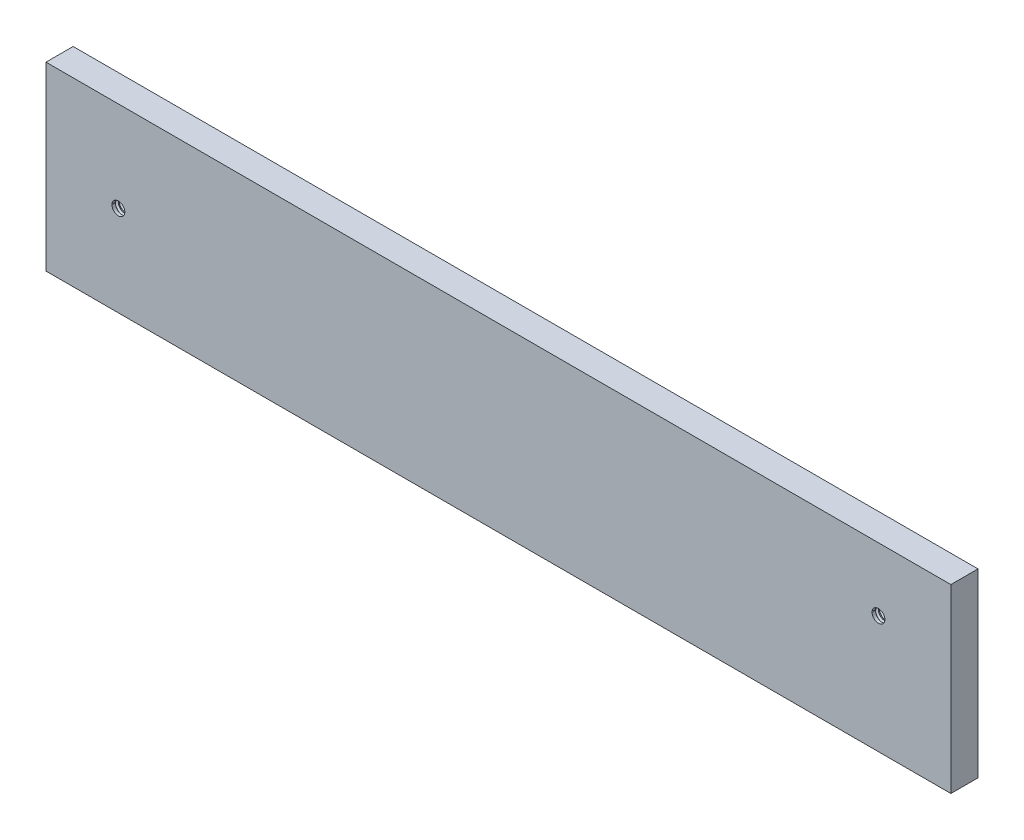
from build123d import *
from build123d.topology import SkipClean

# Parameters (mm, degrees)
SKETCH1_W           = 158.75
SKETCH1_H           = 31.75
BOSS_EXTRUDE1_DEPTH = 4.7625
SKETCH2_R           = 1.1303
CUT_EXTRUDE1_DEPTH  = 127.612750018
THREAD1_PITCH       = 0.635
THREAD2_PITCH       = 0.635


with BuildPart() as part:
    # Sketch1 → Boss-Extrude1 (new body)
    with BuildSketch(Plane.XY):
        with Locations((44.816346154, -8.303846154)):
            Rectangle(SKETCH1_W, SKETCH1_H)
    extrude(amount=-BOSS_EXTRUDE1_DEPTH)

    # Sketch2 → Cut-Extrude1 (cut, through all)
    with BuildSketch(Plane.XY):
        with Locations((-21.858653846, -8.303846154)):
            Circle(SKETCH2_R)
        with Locations((111.491346154, -3.541346154)):
            Circle(SKETCH2_R)
    extrude(amount=-CUT_EXTRUDE1_DEPTH, mode=Mode.SUBTRACT)

    # Thread1: the profile of Thread Profile1 profile screwed along a right-hand helix of 15.748031 turns, 6 arcs to a turn; built about Z, then put on its axis
    with SkipClean():  # the faces are left unmerged after this step: merging them gives an invalid solid
        thread1_z = Axis((0, 0, 0), (0, 0, 1))
        thread1_corners = [(1.13, 0, -0.000173205), (1.474003831, 0, 0.198437499), (1.474003831, 0, 0.277812499), (1.13, 0, 0.476423203)]
        with BuildLine(mode=Mode.PRIVATE) as thread1_profile:
            Line(thread1_corners[0], thread1_corners[1])
            Line(thread1_corners[1], thread1_corners[2])
            Line(thread1_corners[2], thread1_corners[3])
            Line(thread1_corners[3], thread1_corners[0])
        thread1_cap = Face(thread1_profile.wire())
        thread1_turn_angles = [0, 30, 60, 90, 120, 150, 180, 210, 240, 270, 300, 330, 360]
        thread1_turn_weights = [1, 0.8660254037844387, 1, 0.8660254037844387, 1, 0.8660254037844387, 1, 0.8660254037844387, 1, 0.8660254037844387, 1, 0.8660254037844387, 1]
        thread1_turn_rails = [Edge.make_bspline([Vector(p[0], p[1], 0).rotate(thread1_z, thread1_turn_angles[k]) / thread1_turn_weights[k] + Vector(0, 0, p[2] + THREAD1_PITCH * thread1_turn_angles[k] / 360) for k in range(13)], [0, 0, 0, 1, 1, 2, 2, 3, 3, 4, 4, 5, 5, 6, 6, 6], 2, thread1_turn_weights) for p in thread1_corners]
        thread1_turn_sides = [Face.make_surface_from_curves(thread1_turn_rails[p[0]], thread1_turn_rails[p[1]]) for p in [(0, 1), (1, 2), (2, 3), (3, 0)]]
        thread1_last_angles = [5400, 5430, 5460, 5490, 5520, 5550, 5580, 5610, 5640, 5654.645669291, 5669.291338583]
        thread1_last_weights = [1, 0.8660254037844387, 1, 0.8660254037844387, 1, 0.8660254037844387, 1, 0.8660254037844387, 1, 0.9675079437748935, 1]
        thread1_last_rails = [Edge.make_bspline([Vector(p[0], p[1], 0).rotate(thread1_z, thread1_last_angles[k]) / thread1_last_weights[k] + Vector(0, 0, p[2] + THREAD1_PITCH * thread1_last_angles[k] / 360) for k in range(11)], [0, 0, 0, 1, 1, 2, 2, 3, 3, 4, 4, 5, 5, 5], 2, thread1_last_weights) for p in thread1_corners]
        thread1_last_sides = [Face.make_surface_from_curves(thread1_last_rails[p[0]], thread1_last_rails[p[1]]) for p in [(0, 1), (1, 2), (2, 3), (3, 0)]]
        thread1 = Plane(origin=(111.491346154, -3.541346154, 0), x_dir=(-1, 0, 0), z_dir=(0, 0, -1)) * Solid(Shell([*[p.moved(Location((0, 0, THREAD1_PITCH * i))) for i in range(15) for p in thread1_turn_sides], *thread1_last_sides, thread1_cap, thread1_cap.rotate(thread1_z, 5669.291338583).moved(Location((0, 0, THREAD1_PITCH * 5669.291338583 / 360)))]))
        add(thread1, mode=Mode.SUBTRACT)

    # Thread2: the profile of Thread Profile2 profile screwed along a right-hand helix of 15.748031 turns, 6 arcs to a turn; built about Z, then put on its axis
    with SkipClean():  # the faces are left unmerged after this step: merging them gives an invalid solid
        thread2_z = Axis((0, 0, 0), (0, 0, 1))
        thread2_corners = [(1.13, 0, -0.000173205), (1.474003831, 0, 0.198437499), (1.474003831, 0, 0.277812499), (1.13, 0, 0.476423203)]
        with BuildLine(mode=Mode.PRIVATE) as thread2_profile:
            Line(thread2_corners[0], thread2_corners[1])
            Line(thread2_corners[1], thread2_corners[2])
            Line(thread2_corners[2], thread2_corners[3])
            Line(thread2_corners[3], thread2_corners[0])
        thread2_cap = Face(thread2_profile.wire())
        thread2_turn_angles = [0, 30, 60, 90, 120, 150, 180, 210, 240, 270, 300, 330, 360]
        thread2_turn_weights = [1, 0.8660254037844387, 1, 0.8660254037844387, 1, 0.8660254037844387, 1, 0.8660254037844387, 1, 0.8660254037844387, 1, 0.8660254037844387, 1]
        thread2_turn_rails = [Edge.make_bspline([Vector(p[0], p[1], 0).rotate(thread2_z, thread2_turn_angles[k]) / thread2_turn_weights[k] + Vector(0, 0, p[2] + THREAD2_PITCH * thread2_turn_angles[k] / 360) for k in range(13)], [0, 0, 0, 1, 1, 2, 2, 3, 3, 4, 4, 5, 5, 6, 6, 6], 2, thread2_turn_weights) for p in thread2_corners]
        thread2_turn_sides = [Face.make_surface_from_curves(thread2_turn_rails[p[0]], thread2_turn_rails[p[1]]) for p in [(0, 1), (1, 2), (2, 3), (3, 0)]]
        thread2_last_angles = [5400, 5430, 5460, 5490, 5520, 5550, 5580, 5610, 5640, 5654.645669291, 5669.291338583]
        thread2_last_weights = [1, 0.8660254037844387, 1, 0.8660254037844387, 1, 0.8660254037844387, 1, 0.8660254037844387, 1, 0.9675079437748935, 1]
        thread2_last_rails = [Edge.make_bspline([Vector(p[0], p[1], 0).rotate(thread2_z, thread2_last_angles[k]) / thread2_last_weights[k] + Vector(0, 0, p[2] + THREAD2_PITCH * thread2_last_angles[k] / 360) for k in range(11)], [0, 0, 0, 1, 1, 2, 2, 3, 3, 4, 4, 5, 5, 5], 2, thread2_last_weights) for p in thread2_corners]
        thread2_last_sides = [Face.make_surface_from_curves(thread2_last_rails[p[0]], thread2_last_rails[p[1]]) for p in [(0, 1), (1, 2), (2, 3), (3, 0)]]
        thread2 = Plane(origin=(-21.858653846, -8.303846154, 0), x_dir=(-1, 0, 0), z_dir=(0, 0, -1)) * Solid(Shell([*[p.moved(Location((0, 0, THREAD2_PITCH * i))) for i in range(15) for p in thread2_turn_sides], *thread2_last_sides, thread2_cap, thread2_cap.rotate(thread2_z, 5669.291338583).moved(Location((0, 0, THREAD2_PITCH * 5669.291338583 / 360)))]))
        add(thread2, mode=Mode.SUBTRACT)


solid = part.part
